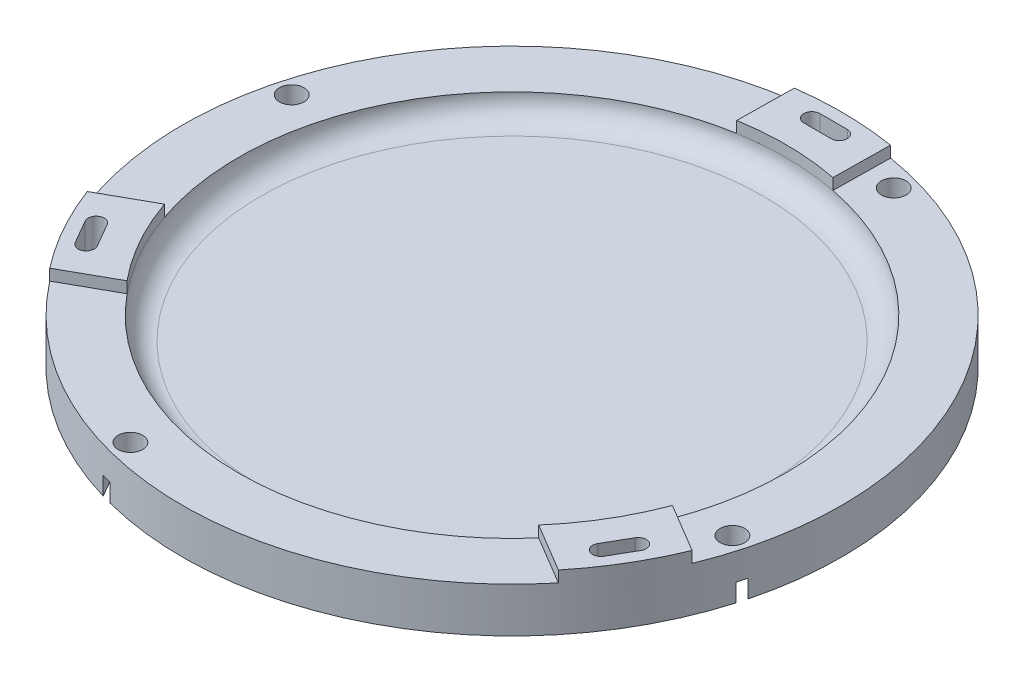
from build123d import *
from build123d.topology import SkipClean

# Parameters (mm, degrees)
CROQUIS1_R                                     = 73.5
SALIENTE_EXTRUIR1_DEPTH                        = 5
CROQUIS7_R                                     = 73.5
CROQUIS7_R_2                                   = 61
SALIENTE_EXTRUIR2_DEPTH                        = 5
CROQUIS8_R                                     = 2.75
CORTAR_EXTRUIR5_DEPTH                          = 105.424613957
CORTAR_EXTRUIR6_DEPTH                          = 4
BOSS_EXTRUDE1_DEPTH                            = 2.5
CSK_SLOT_FOR_M3_FLAT_HEAD_MACHINE_SCREW1_DEPTH = 12.5
CIRPATTERN1_COUNT                              = 3
FILLET3_R                                      = 5


with BuildPart() as part:
    # Croquis1 → Saliente-Extruir1 (new body)
    with BuildSketch(Plane(origin=(0, 0, 0), x_dir=(1, 0, 0), z_dir=(0, 1, 0))):
        with Locations(Location((0, 0, 0), (0, 0, 270))):
            Circle(CROQUIS1_R)
    extrude(amount=SALIENTE_EXTRUIR1_DEPTH)

    # Croquis7 → Saliente-Extruir2 (add)
    with BuildSketch(Plane(origin=(0, 5, 0), x_dir=(1, 0, 0), z_dir=(0, 1, 0))):
        with Locations(Location((0, 0, 0), (0, 0, 270))):
            Circle(CROQUIS7_R)
        with Locations(Location((0, 0, 0), (0, 0, 270))):
            Circle(CROQUIS7_R_2, mode=Mode.SUBTRACT)
    extrude(amount=SALIENTE_EXTRUIR2_DEPTH)

    # Croquis8 → Cortar-Extruir5 (cut, through all)
    with BuildSketch(Plane(origin=(0, 10, 0), x_dir=(1, 0, 0), z_dir=(0, 1, 0))):
        with Locations(Location((-17.987923635, -67.131844927, 0), (0, 0, 270))):
            Circle(CROQUIS8_R)
        with Locations(Location((-67.131844927, 17.987923635, 0), (0, 0, 270))):
            Circle(CROQUIS8_R)
        with Locations(Location((17.987923635, 67.131844927, 0), (0, 0, 270))):
            Circle(CROQUIS8_R)
        with Locations(Location((67.131844927, -17.987923635, 0), (0, 0, 270))):
            Circle(CROQUIS8_R)
    extrude(amount=-CORTAR_EXTRUIR5_DEPTH, mode=Mode.SUBTRACT)

    # Croquis9 → Cortar-Extruir6 (cut)
    with BuildSketch(Plane(origin=(0, 0, 0), x_dir=(-1, 0, 0), z_dir=(0, -1, 0))):
        Polygon((20.297324711, -63.131844927), (15.678522558, -63.131844927), (13.369121481, -67.131844927), (15.678522558, -71.131844927), (20.297324711, -71.131844927), (22.606725788, -67.131844927), align=None)
        Polygon((-63.131844927, -20.297324711), (-63.131844927, -15.678522558), (-67.131844927, -13.369121481), (-71.131844927, -15.678522558), (-71.131844927, -20.297324711), (-67.131844927, -22.606725788), align=None)
        Polygon((-20.297324711, 63.131844927), (-15.678522558, 63.131844927), (-13.369121481, 67.131844927), (-15.678522558, 71.131844927), (-20.297324711, 71.131844927), (-22.606725788, 67.131844927), align=None)
        Polygon((63.131844927, 20.297324711), (63.131844927, 15.678522558), (67.131844927, 13.369121481), (71.131844927, 15.678522558), (71.131844927, 20.297324711), (67.131844927, 22.606725788), align=None)
    extrude(amount=-CORTAR_EXTRUIR6_DEPTH, mode=Mode.SUBTRACT)

    # Sketch3 → Boss-Extrude1 (add)
    with SkipClean():  # the faces are left unmerged after this step: merging them gives an invalid solid
        with BuildSketch(Plane(origin=(0, 10, 0), x_dir=(1, 0, 0), z_dir=(0, 1, 0))):
            with BuildLine():
                Line((11.696105723, 59.868197826), (11.869621272, 72.535247231))
                ThreePointArc((11.869621272, 72.535247231), (1.004194341, 73.493139773), (-9.883348207, 72.832475093))
                Line((-9.883348207, 72.832475093), (-10.056865919, 60.165267787))
                ThreePointArc((-10.056865919, 60.165267787), (0.832970242, 60.994312526), (11.696105723, 59.868197826))
            make_face()
            with BuildLine():
                Line((-57.695433057, -19.804974232), (-68.752177408, -25.98823006))
                ThreePointArc((-68.752177408, -25.98823006), (-64.149023218, -35.876912077), (-58.133099548, -44.975468168))
                Line((-58.133099548, -44.975468168), (-47.076217369, -38.792135262))
                ThreePointArc((-47.076217369, -38.792135262), (-53.239109255, -29.775782873), (-57.695433057, -19.804974232))
            make_face()
            with BuildLine():
                Line((45.999327335, -40.063223594), (56.882556136, -46.547017171))
                ThreePointArc((56.882556136, -46.547017171), (63.144828877, -37.616227696), (68.016447755, -27.857006925))
                Line((68.016447755, -27.857006925), (57.133083289, -21.373132525))
                ThreePointArc((57.133083289, -21.373132525), (52.406139013, -31.218529653), (45.999327335, -40.063223594))
            make_face()
        extrude(amount=BOSS_EXTRUDE1_DEPTH)

    # CSK SLOT for M3 Flat Head Machine Screw1: read off the stored shape, not the designer's step
    # CSK SLOT for M3 Flat Head Machine Sc 2 → CSK SLOT for M3 Flat Head Machine Screw1 (cut)
    with SkipClean():  # the faces are left unmerged after this step: merging them gives an invalid solid
        with BuildSketch(Plane(origin=(0, 0, 0), x_dir=(1, 0, 0), z_dir=(0, 1, 0))):
            with BuildLine():
                ThreePointArc((-60.230442327, -37.210480227), (-57.7715966, -37.869325954), (-57.112750874, -35.410480227))
                Line((-57.112750874, -35.410480227), (-60.167750874, -30.11906501))
                ThreePointArc((-60.167750874, -30.11906501), (-62.626596601, -29.460219283), (-63.285442327, -31.91906501))
                Line((-63.285442327, -31.91906501), (-60.230442327, -37.210480227))
            make_face()
        csk_slot_for_m3_flat_head_machine_screw1 = extrude(amount=CSK_SLOT_FOR_M3_FLAT_HEAD_MACHINE_SCREW1_DEPTH, mode=Mode.SUBTRACT)

    # CSK SLOT for M3 Flat Head Machine Sc 3: loft between two sections, ruled curve by curve
    with SkipClean():  # the faces are left unmerged after this step: merging them gives an invalid solid
        csk_slot_for_m3_flat_head_machine_sc_3_from = [
            Edge.make_three_point_arc((-57.112750874, 1.35, 35.410480227), (-56.932930113, 1.35, 36.776354508), (-57.7715966, 1.35, 37.869325954)),
            Edge.make_three_point_arc((-57.7715966, 1.35, 37.869325954), (-59.137470882, 1.35, 38.049146714), (-60.230442327, 1.35, 37.210480227)),
            Edge.make_three_point_arc((-63.285442327, 1.35, 31.91906501), (-63.465263088, 1.35, 30.553190729), (-62.6265966, 1.35, 29.460219283)),
            Edge.make_three_point_arc((-62.6265966, 1.35, 29.460219283), (-61.260722319, 1.35, 29.280398523), (-60.167750874, 1.35, 30.11906501)),
            Edge.make_line((-60.230442327, 1.35, 37.210480227), (-63.285442327, 1.35, 31.91906501)),
            Edge.make_line((-57.112750874, 1.35, 35.410480227), (-60.167750874, 1.35, 30.11906501)),
        ]
        csk_slot_for_m3_flat_head_machine_sc_3_to = [
            Edge.make_three_point_arc((-55.943616578, 0, 34.735480227), (-55.628930248, 0, 37.125760219), (-57.0965966, 0, 39.038460249)),
            Edge.make_three_point_arc((-57.0965966, 0, 39.038460249), (-59.486876592, 0, 39.35314658), (-61.399576622, 0, 37.885480227)),
            Edge.make_three_point_arc((-64.454576622, 0, 32.59406501), (-64.769262953, 0, 30.203785018), (-63.3015966, 0, 28.291084988)),
            Edge.make_three_point_arc((-63.3015966, 0, 28.291084988), (-60.911316608, 0, 27.976398657), (-58.998616578, 0, 29.44406501)),
            Edge.make_line((-61.399576622, 0, 37.885480227), (-64.454576622, 0, 32.59406501)),
            Edge.make_line((-55.943616578, 0, 34.735480227), (-58.998616578, 0, 29.44406501)),
        ]
        csk_slot_for_m3_flat_head_machine_sc_3 = Solid(Shell([*[Face.make_surface_from_curves(csk_slot_for_m3_flat_head_machine_sc_3_from[k], csk_slot_for_m3_flat_head_machine_sc_3_to[k]) for k in range(6)], Face(Wire(csk_slot_for_m3_flat_head_machine_sc_3_from)), Face(Wire(csk_slot_for_m3_flat_head_machine_sc_3_to))]))
        add(csk_slot_for_m3_flat_head_machine_sc_3, mode=Mode.SUBTRACT)

    # CirPattern1: CSK SLOT for M3 Flat Head Machine Screw1, CSK SLOT for M3 Flat Head Machine Sc 3 ×3 about axis
    with SkipClean():  # the faces are left unmerged after this step: merging them gives an invalid solid
        cirpattern1_axis = Axis((0, 0, 0), (0, 1, 0))
        add([csk_slot_for_m3_flat_head_machine_screw1.rotate(cirpattern1_axis, i * 360 / CIRPATTERN1_COUNT) for i in range(1, CIRPATTERN1_COUNT)], mode=Mode.SUBTRACT)
        add([csk_slot_for_m3_flat_head_machine_sc_3.rotate(cirpattern1_axis, i * 360 / CIRPATTERN1_COUNT) for i in range(1, CIRPATTERN1_COUNT)], mode=Mode.SUBTRACT)

    # Fillet3
    fillet3_edges = [part.edges().sort_by_distance(p)[0] for p in [
        (0, 5, -61),
    ]]
    fillet(fillet3_edges, radius=FILLET3_R - 0.0001)  # a hair under: the kernel refuses the full size


solid = part.part
